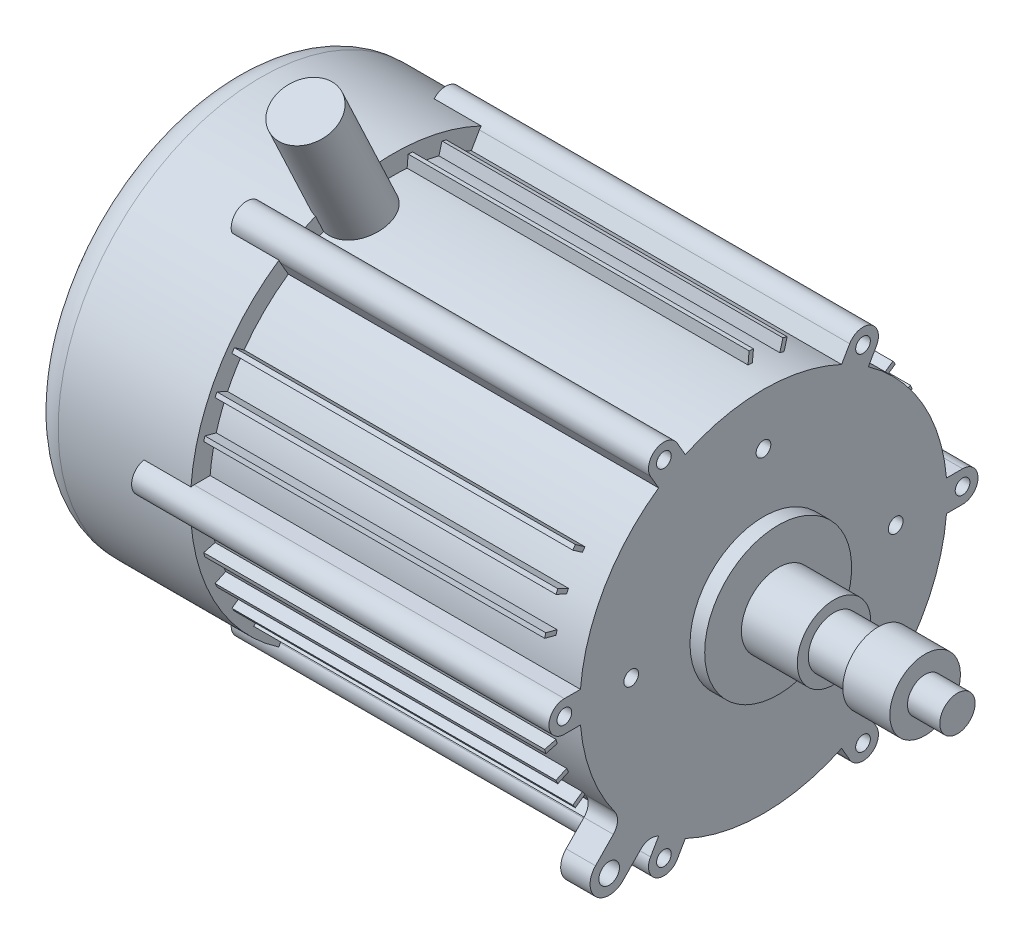
from build123d import *

# Parameters (mm, degrees)
FILLET_1_R            = 10
SKETCH_2_R            = 2.5
EXTRUDE_1_DEPTH       = 142
EXTRUDE_START         = -10
EXTRUDE_2_DEPTH       = 132
SKETCH_4_R            = 3.5
EXTRUDE_3_DEPTH       = 10
FILLET_2_R            = 5
HOLE_WIZARD_M61_D     = 5
HOLE_WIZARD_M61_DEPTH = 15
HOLE_WIZARD_M61_TIP   = 1.502151548
EXTRUDE_4_DEPTH       = 40
EXTRUDE_4_DEPTH_BACK  = 10
SKETCH_8_R            = 10


with BuildPart() as part:
    # Эскиз1 → Повернуть1 (revolve)
    with BuildSketch(Plane.XY, mode=Mode.PRIVATE) as revolve_1_sk:
        Polygon((-181, 0), (-181, 69), (-126, 69), (-126, 62.5), (0, 62.5), (0, 25), (5, 25), (5, 12.5), (24, 12.5), (24, 8.75), (39, 8.75), (39, 12), (55, 12), (55, 6), (66, 6), (66, 0), align=None)
    revolve(revolve_1_sk.sketch.rotate(Axis((-1000, 0, 0), (1, 0, 0)), 90), axis=Axis((-1000, 0, 0), (1, 0, 0)))

    # Скругление1
    fillet_1_edges = [part.edges().sort_by_distance(p)[0] for p in [
        (-181, 0, -69),
    ]]
    fillet(fillet_1_edges, radius=FILLET_1_R)

    # Эскиз2 → Бобышка-Вытянуть1 (add)
    # profile 1 of 6: a face of its own
    with BuildSketch(Plane(origin=(0, 0, 0), x_dir=(0, 0, -1), z_dir=(1, 0, 0))):
        with BuildLine():
            Line((19.32836663, 43.977713031), (28.42163337, 38.727713031))
            Line((28.42163337, 38.727713031), (38.42163337, 56.048221106))
            ThreePointArc((38.42163337, 56.048221106), (36.5, 63.219854476), (29.32836663, 61.298221106))
            Line((29.32836663, 61.298221106), (19.32836663, 43.977713031))
        make_face()
        with Locations((33.875, 58.673221106)):
            Circle(SKETCH_2_R, mode=Mode.SUBTRACT)
    # profile 2 of 6: a face of its own
    with BuildSketch(Plane(origin=(0, 0, 0), x_dir=(0, 0, -1), z_dir=(1, 0, 0))):
        with BuildLine():
            Line((47.75, 5.25), (67.75, 5.25))
            ThreePointArc((67.75, 5.25), (73, 0), (67.75, -5.25))
            Line((67.75, -5.25), (47.75, -5.25))
            Line((47.75, -5.25), (47.75, 5.25))
        make_face()
        with Locations((67.75, 0)):
            Circle(SKETCH_2_R, mode=Mode.SUBTRACT)
    # profile 3 of 6: a face of its own
    with BuildSketch(Plane(origin=(0, 0, 0), x_dir=(0, 0, -1), z_dir=(1, 0, 0))):
        with BuildLine():
            Line((28.42163337, -38.727713031), (38.42163337, -56.048221106))
            ThreePointArc((38.42163337, -56.048221106), (36.5, -63.219854476), (29.32836663, -61.298221106))
            Line((29.32836663, -61.298221106), (19.32836663, -43.977713031))
            Line((19.32836663, -43.977713031), (28.42163337, -38.727713031))
        make_face()
        with Locations((33.875, -58.673221106)):
            Circle(SKETCH_2_R, mode=Mode.SUBTRACT)
    # profile 4 of 6: a face of its own
    with BuildSketch(Plane(origin=(0, 0, 0), x_dir=(0, 0, -1), z_dir=(1, 0, 0))):
        with BuildLine():
            Line((-19.32836663, -43.977713031), (-29.32836663, -61.298221106))
            ThreePointArc((-29.32836663, -61.298221106), (-36.5, -63.219854476), (-38.42163337, -56.048221106))
            Line((-38.42163337, -56.048221106), (-28.42163337, -38.727713031))
            Line((-28.42163337, -38.727713031), (-19.32836663, -43.977713031))
        make_face()
        with Locations((-33.875, -58.673221106)):
            Circle(SKETCH_2_R, mode=Mode.SUBTRACT)
    # profile 5 of 6: a face of its own
    with BuildSketch(Plane(origin=(0, 0, 0), x_dir=(0, 0, -1), z_dir=(1, 0, 0))):
        with BuildLine():
            Line((-47.75, -5.25), (-67.75, -5.25))
            ThreePointArc((-67.75, -5.25), (-73, 0), (-67.75, 5.25))
            Line((-67.75, 5.25), (-47.75, 5.25))
            Line((-47.75, 5.25), (-47.75, -5.25))
        make_face()
        with Locations((-67.75, 0)):
            Circle(SKETCH_2_R, mode=Mode.SUBTRACT)
    # profile 6 of 6: a face of its own
    with BuildSketch(Plane(origin=(0, 0, 0), x_dir=(0, 0, -1), z_dir=(1, 0, 0))):
        with BuildLine():
            Line((-28.42163337, 38.727713031), (-38.42163337, 56.048221106))
            ThreePointArc((-38.42163337, 56.048221106), (-36.5, 63.219854476), (-29.32836663, 61.298221106))
            Line((-29.32836663, 61.298221106), (-19.32836663, 43.977713031))
            Line((-19.32836663, 43.977713031), (-28.42163337, 38.727713031))
        make_face()
        with Locations((-33.875, 58.673221106)):
            Circle(SKETCH_2_R, mode=Mode.SUBTRACT)
    extrude(amount=-EXTRUDE_1_DEPTH)

    # Эскиз3 → Бобышка-Вытянуть2 (add)
    with BuildSketch(Plane(origin=(0, 0, 0), x_dir=(0, 0, -1), z_dir=(1, 0, 0)).offset(EXTRUDE_START)):
        Polygon((-18.057581098, -64.005751811), (-16.609432771, -64.39673317), (-15.549587801, -60.4711938), (-16.997736128, -60.080212441), align=None)
        Polygon((-6.58791803, -66.177124719), (-5.093715055, -66.30887246), (-4.736582476, -62.258491364), (-6.230785451, -62.126743622), align=None)
        Polygon((5.084720547, -66.309562787), (6.578941379, -66.178017727), (6.222358218, -62.127588225), (4.728137385, -62.259133284), align=None)
        Polygon((16.600697529, -64.398985563), (18.048898877, -64.008200641), (16.989586397, -60.082517544), (15.541385049, -60.473302466), align=None)
        Polygon((-64.459397606, -16.364551944), (-64.073923232, -17.814175863), (-60.144383929, -16.769258846), (-60.529858303, -15.319634927), align=None)
        Polygon((-60.605030171, -27.383257987), (-59.972025574, -28.743149593), (-56.28572636, -27.027244931), (-56.918730957, -25.667353324), align=None)
        Polygon((-54.883405614, -37.558278558), (-54.022373834, -38.786539228), (-50.69289057, -36.4525144), (-51.553922349, -35.22425373), align=None)
        Polygon((-47.470808711, -46.576118562), (-46.408278367, -47.634905259), (-43.538193318, -44.754672192), (-44.600723662, -43.695885495), align=None)
        Polygon((-54.017112141, 38.793866732), (-54.87831052, 37.565722867), (-51.549143884, 35.231246433), (-50.687945505, 36.459390297), align=None)
        Polygon((-59.96812616, 28.751284229), (-60.601315214, 27.391478499), (-56.915248787, 25.675073825), (-56.282059734, 27.034879554), align=None)
        Polygon((-64.07150624, 17.822867001), (-64.457177244, 16.373295383), (-60.527779715, 15.327845353), (-60.142108711, 16.777416971), align=None)
        Polygon((18.057581098, 64.005751811), (16.609432771, 64.39673317), (15.549587801, 60.4711938), (16.997736128, 60.080212441), align=None)
        Polygon((6.58791803, 66.177124719), (5.093715055, 66.30887246), (4.736582476, 62.258491364), (6.230785451, 62.126743622), align=None)
        Polygon((64.459397606, 16.364551944), (64.073923232, 17.814175863), (60.144383929, 16.769258846), (60.529858303, 15.319634927), align=None)
        Polygon((60.605030171, 27.383257987), (59.972025574, 28.743149593), (56.28572636, 27.027244931), (56.918730957, 25.667353324), align=None)
        Polygon((54.883405614, 37.558278558), (54.022373834, 38.786539228), (50.69289057, 36.4525144), (51.553922349, 35.22425373), align=None)
        Polygon((47.470808711, 46.576118562), (46.408278367, 47.634905259), (43.538193318, 44.754672192), (44.600723662, 43.695885495), align=None)
        Polygon((46.401816508, -47.641199867), (47.464490461, -46.582557307), (44.594796127, -43.701934954), (43.532122174, -44.760577514), align=None)
        Polygon((54.017112141, -38.793866732), (54.87831052, -37.565722867), (51.549143884, -35.231246433), (50.687945505, -36.459390297), align=None)
        Polygon((59.96812616, -28.751284229), (60.601315214, -27.391478499), (56.915248787, -25.675073825), (56.282059734, -27.034879554), align=None)
        Polygon((64.07150624, -17.822867001), (64.457177244, -16.373295383), (60.527779715, -15.327845353), (60.142108711, -16.777416971), align=None)
    extrude(amount=-EXTRUDE_2_DEPTH)

    # Эскиз4 → Бобышка-Вытянуть3 (add)
    # profile 1 of 2: a face of its own
    with BuildSketch(Plane(origin=(0, 0, 0), x_dir=(0, 0, -1), z_dir=(1, 0, 0))):
        with BuildLine():
            Line((-57.153767194, -49.302715199), (-48.050718601, -39.96721709))
            Line((-48.050718601, -39.96721709), (-38.743184212, -49.042998247))
            Line((-38.743184212, -49.042998247), (-47.846232806, -58.378496356))
            ThreePointArc((-47.846232806, -58.378496356), (-57.037890578, -58.494372971), (-57.153767194, -49.302715199))
        make_face()
        with Locations((-52.5, -53.840605777)):
            Circle(SKETCH_4_R, mode=Mode.SUBTRACT)
    # profile 2 of 2: a face of its own
    with BuildSketch(Plane(origin=(0, 0, 0), x_dir=(0, 0, -1), z_dir=(1, 0, 0))):
        with BuildLine():
            Line((57.153767194, -49.302715199), (48.050718601, -39.96721709))
            Line((48.050718601, -39.96721709), (38.743184212, -49.042998247))
            Line((38.743184212, -49.042998247), (47.846232806, -58.378496356))
            ThreePointArc((47.846232806, -58.378496356), (57.037890578, -58.494372971), (57.153767194, -49.302715199))
        make_face()
        with Locations(Location((52.5, -53.840605777, 0), (0, 0, 180))):
            Circle(SKETCH_4_R, mode=Mode.SUBTRACT)
    extrude(amount=-EXTRUDE_3_DEPTH)

    # Скругление2
    # the kernel refuses this fillet: 5 mm, written as the material it adds along each edge
    with BuildSketch(Plane(origin=(0, -39.96721709, 48.050718601), x_dir=(0, 0.7898038127360412, 0.6133595498462648), z_dir=(-1, 0, 0))) as fillet_2_piece_1:
        with BuildLine():
            CenterArc((4.355298088, -4.997193203), FILLET_2_R, 91.919899257, 80.190646136)
            Line((-0.597375629, -4.31088201), (-0.696429103, -4.297155786))
            Line((-0.696429103, -4.297155786), (-0.099053474, 0.013726224))
            Line((-0.099053474, 0.013726224), (0.003350229, 0.099943864))
            ThreePointArc((0.003350229, 0.099943864), (2.093893312, 0.064915039), (4.184436394, 0.099943864))
            Line((4.184436394, 0.099943864), (4.187786623, 0))
        make_face()
    extrude(amount=10)
    with BuildSketch(Plane(origin=(0, -49.042998247, 38.743184212), x_dir=(0, -0.5957111834176017, -0.8031987213331458), z_dir=(-1, 0, 0))) as fillet_2_piece_2:
        with BuildLine():
            CenterArc((4.372725597, 4.967781466), FILLET_2_R, 187.71437929, 75.77774875)
            Line((-0.582022116, 4.296607044), (-0.68111707, 4.283183556))
            Line((-0.68111707, 4.283183556), (-0.099094954, -0.013423488))
            Line((-0.099094954, -0.013423488), (0.003044822, -0.099953635))
            ThreePointArc((0.003044822, -0.099953635), (1.903013496, -0.071021599), (3.794693019, -0.099355629))
            Line((3.794693019, -0.099355629), (3.806026991, 0))
        make_face()
    extrude(amount=10)
    with BuildSketch(Plane(origin=(0, -49.042998247, -38.743184212), x_dir=(0, -0.5957111834175893, 0.8031987213331551), z_dir=(-1, 0, 0))) as fillet_2_piece_3:
        with BuildLine():
            CenterArc((4.372725597, -4.967781466), FILLET_2_R, 96.50787196, 75.77774875)
            Line((-0.582022116, -4.296607044), (-0.68111707, -4.283183556))
            Line((-0.68111707, -4.283183556), (-0.099094954, 0.013423488))
            Line((-0.099094954, 0.013423488), (0.003044822, 0.099953635))
            ThreePointArc((0.003044822, 0.099953635), (1.903013496, 0.071021599), (3.794693019, 0.099355629))
            Line((3.794693019, 0.099355629), (3.806026991, 0))
        make_face()
    extrude(amount=10)
    with BuildSketch(Plane(origin=(0, -39.96721709, -48.050718601), x_dir=(0, 0.7898038127360374, -0.6133595498462694), z_dir=(-1, 0, 0))) as fillet_2_piece_4:
        with BuildLine():
            CenterArc((4.355298088, 4.997193203), FILLET_2_R, 187.889454607, 80.190646136)
            Line((-0.597375629, 4.31088201), (-0.696429103, 4.297155786))
            Line((-0.696429103, 4.297155786), (-0.099053474, -0.013726224))
            Line((-0.099053474, -0.013726224), (0.003350229, -0.099943864))
            ThreePointArc((0.003350229, -0.099943864), (2.093893312, -0.064915039), (4.184436394, -0.099943864))
            Line((4.184436394, -0.099943864), (4.187786623, 0))
        make_face()
    extrude(amount=10)

    # Отверстие обработанное метчиком M61
    with Locations(Plane(origin=(0, 0, 0), x_dir=(0, 0, -1), z_dir=(1, 0, 0))):
        with Locations((0, 45), (45, 0), (-45, 0)):
            Hole(HOLE_WIZARD_M61_D / 2, depth=HOLE_WIZARD_M61_DEPTH)
            with Locations((0, 0, -(HOLE_WIZARD_M61_DEPTH + HOLE_WIZARD_M61_TIP / 2))):  # 118° drill point
                Cone(0, HOLE_WIZARD_M61_D / 2, HOLE_WIZARD_M61_TIP, mode=Mode.SUBTRACT)

    # Эскиз8 → Бобышка-Вытянуть4 (add, two sides: drawn at the far end of the back side and taken through both)
    with BuildSketch(Plane(origin=(0, 56.56029109, 26.59292146), x_dir=(1, 0, 0), z_dir=(0, 0.9049646574454886, 0.42548674335937864)).offset(-EXTRUDE_4_DEPTH_BACK)):
        with Locations(Location((-124, 13, 0), (0, 0, 270))):
            Circle(SKETCH_8_R)
    extrude(amount=EXTRUDE_4_DEPTH + EXTRUDE_4_DEPTH_BACK)


solid = part.part
